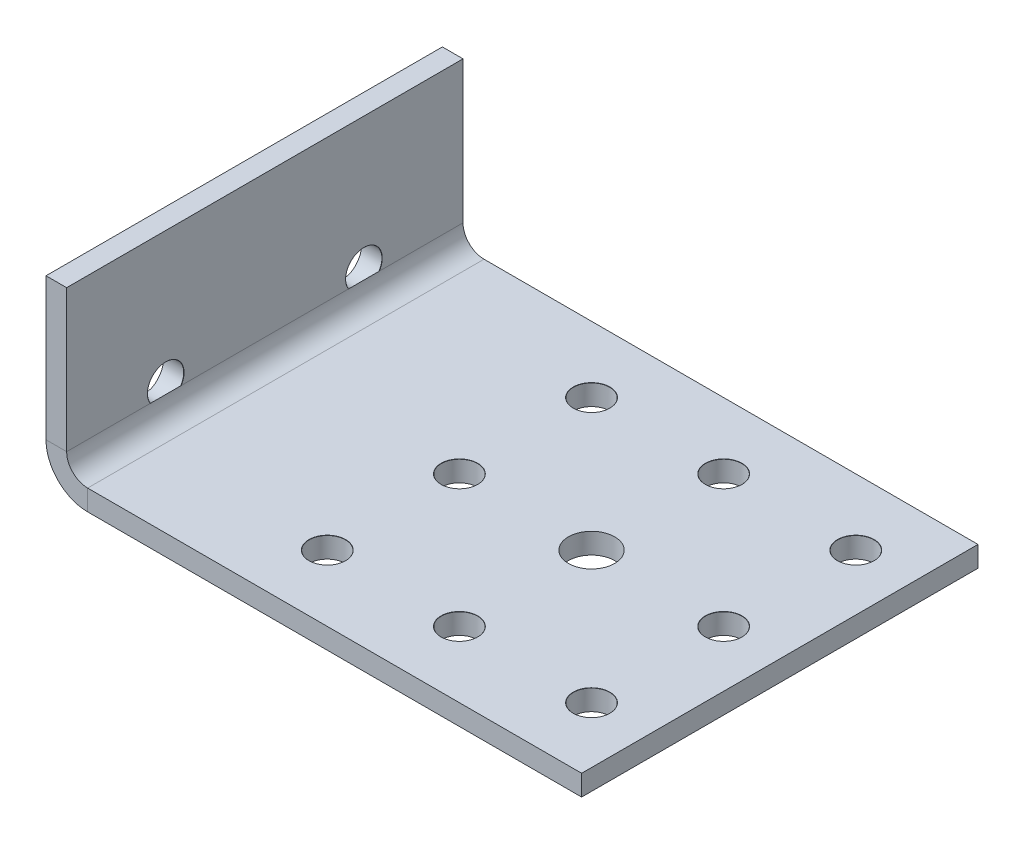
from build123d import *

# Parameters (mm, degrees)
SKETCH1_W                      = 150
SKETCH1_H                      = 60
BOSS_EXTRUDE1_DEPTH            = 3.175
CONVERT_SOLID1_OUTLINE_W       = 150
CONVERT_SOLID1_OUTLINE_H       = 60
CONVERT_SOLID1_DEPTH           = 0.05
SKETCHED_START                 = -30
SKETCHED_BEND1_DEPTH           = 60
SKETCHED_BEND1_2_DEPTH         = 60
SKETCH12_W                     = 13.513441401
SKETCH12_H                     = 61.735090191
CUT_EXTRUDE1_DEPTH             = 51.24
SKETCH13_R                     = 3.5
CUT_EXTRUDE2_DEPTH             = 10
SKETCH14_W                     = 60
SKETCH14_H                     = 3.125
BOSS_EXTRUDE2_DEPTH            = 3.5
M5_CLEARANCE_HOLE1_D           = 5.5
M5_CLEARANCE_HOLE1_DEPTH       = 10.1
M5_CLEARANCE_HOLE1_CSINK_D     = 5.55
M5_CLEARANCE_HOLE1_CSINK_ANGLE = 90
M5_CLEARANCE_HOLE1_TIP         = 1.652366702
M5_CLEARANCE_HOLE2_AT_2_COUNT  = 2
M5_CLEARANCE_HOLE2_AT_2_PITCH  = 30


# Read off the part's stored shape, not the designer's step: Convert-Solid1, Sketched Bend1
with BuildPart() as part:
    # Sketch1 → Boss-Extrude1 (new body)
    with BuildSketch(Plane(origin=(0, 0, 0), x_dir=(1, 0, 0), z_dir=(0, 1, 0))):
        Rectangle(SKETCH1_W, SKETCH1_H)
    extrude(amount=BOSS_EXTRUDE1_DEPTH)

    # Convert-Solid1 outline → Convert-Solid1 (cut)
    with BuildSketch(Plane(origin=(0, 0, 0), x_dir=(1, 0, 0), z_dir=(0, 1, 0))):
        Rectangle(CONVERT_SOLID1_OUTLINE_W, CONVERT_SOLID1_OUTLINE_H)
    extrude(amount=CONVERT_SOLID1_DEPTH, mode=Mode.SUBTRACT)

    # Sketched Bend1 outline → Sketched Bend1 (cut)
    with BuildSketch(Plane.XY.offset(SKETCHED_START)):
        with BuildLine():
            ThreePointArc((3.72475079, 0.05), (0.586030908, 0.886777026), (-1.719569645, 3.175))
            Line((-1.719569645, 3.175), (-75, 3.175))
            Line((-75, 3.175), (-75, 0.05))
            Line((-75, 0.05), (3.72475079, 0.05))
        make_face()
    extrude(amount=SKETCHED_BEND1_DEPTH, mode=Mode.SUBTRACT)

    # Sketched Bend1 2 outline → Sketched Bend1 2 (add)
    with BuildSketch(Plane.XY.offset(SKETCHED_START)):
        with BuildLine():
            Line((0.54475079, 77.63024921), (-2.58024921, 77.63024921))
            Line((-2.58024921, 77.63024921), (-2.58024921, 6.355))
            ThreePointArc((-2.58024921, 6.355), (-2.361276869, 4.707792567), (-1.719569645, 3.175))
            Line((-1.719569645, 3.175), (3.72475079, 3.175))
            ThreePointArc((3.72475079, 3.175), (1.476151226, 4.106400436), (0.54475079, 6.355))
            Line((0.54475079, 6.355), (0.54475079, 77.63024921))
        make_face()
    extrude(amount=SKETCHED_BEND1_2_DEPTH)

    # Sketch12 → Cut-Extrude1 (cut)
    with BuildSketch(Plane(origin=(0, 79.093833736, 0), x_dir=(1, 0, 0), z_dir=(0, 1, 0))):
        with Locations((-1.719442409, -0.853480509)):
            Rectangle(SKETCH12_W, SKETCH12_H)
    extrude(amount=-CUT_EXTRUDE1_DEPTH, mode=Mode.SUBTRACT)

    # Sketch13 → Cut-Extrude2 (cut)
    with BuildSketch(Plane(origin=(0, 3.175, 0), x_dir=(1, 0, 0), z_dir=(0, 1, 0))):
        with Locations(Location((50, 0, 0), (0, 0, 270))):
            Circle(SKETCH13_R)
    extrude(amount=-CUT_EXTRUDE2_DEPTH, mode=Mode.SUBTRACT)

    # Sketch14 → Boss-Extrude2 (add)
    with BuildSketch(Plane(origin=(75, 0, 0), x_dir=(0, 0, -1), z_dir=(1, 0, 0))):
        with Locations((0, 1.6125)):
            Rectangle(SKETCH14_W, SKETCH14_H)
    extrude(amount=BOSS_EXTRUDE2_DEPTH)

    # M5 Clearance Hole1
    with Locations(Plane(origin=(0, 3.175, 0), x_dir=(1, 0, 0), z_dir=(0, 1, 0))):
        with Locations((30, 20), (70, 20), (70, -20), (30, -20), (50, 20), (50, -20), (70, 0), (30, 0)):
            CounterSinkHole(M5_CLEARANCE_HOLE1_D / 2, M5_CLEARANCE_HOLE1_CSINK_D / 2, depth=M5_CLEARANCE_HOLE1_DEPTH, counter_sink_angle=M5_CLEARANCE_HOLE1_CSINK_ANGLE)
            with Locations((0, 0, -(M5_CLEARANCE_HOLE1_DEPTH + M5_CLEARANCE_HOLE1_TIP / 2))):  # 118° drill point
                Cone(0, M5_CLEARANCE_HOLE1_D / 2, M5_CLEARANCE_HOLE1_TIP, mode=Mode.SUBTRACT)

    # Sketch21 → M5 Clearance Hole2 (revolve, cut)
    with BuildSketch(Plane(origin=(0.54475079, 7.853833736, 15), x_dir=(0, 0, -1), z_dir=(0, 1, 0))):
        Polygon((0, 0), (0, 11.752366702), (2.75, 10.1), (2.75, 0.025), (2.775, 0), align=None)
    m5_clearance_hole2 = revolve(axis=Axis((6.89475079, 7.853833736, 15), (-1, 0, 0)), mode=Mode.SUBTRACT)

    # M5 Clearance Hole2 at 2: M5 Clearance Hole2 ×2
    with Locations(*[(0, 0, -i * M5_CLEARANCE_HOLE2_AT_2_PITCH) for i in range(1, M5_CLEARANCE_HOLE2_AT_2_COUNT)]):
        add(m5_clearance_hole2, mode=Mode.SUBTRACT)


solid = part.part
